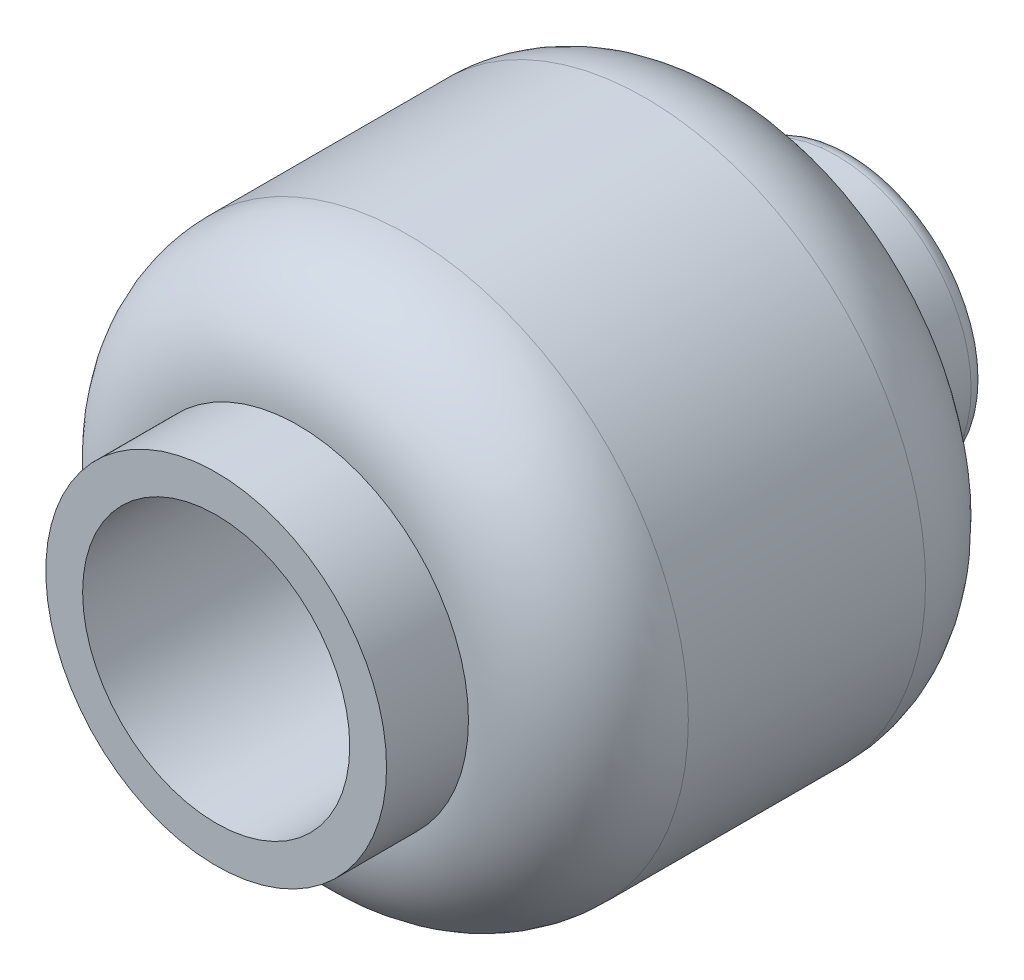
from build123d import *

# Parameters (mm, degrees)
FILLET2_R = 50.8
FILLET3_R = 7.62


with BuildPart() as part:
    # Sketch1 → Revolve1 (revolve)
    with BuildSketch(Plane(origin=(0, 0, 0), x_dir=(1, 0, 0), z_dir=(0, 1, 0)), mode=Mode.PRIVATE) as revolve1_sk:
        Polygon((-78.74, 0), (-61.722, 0), (-61.722, 147.1422), (0, 147.1422), (0, 294.2844), (-62.23, 294.2844), (-62.23, 249.0724), (-129.54, 249.0724), (-129.54, 37.846), (-78.74, 37.846), align=None)
    revolve(revolve1_sk.sketch.rotate(Axis((0, 0, 0), (0, 0, -1)), 180), axis=Axis((0, 0, 0), (0, 0, -1)))

    # Fillet2
    fillet2_edges = [part.edges().sort_by_distance(p)[0] for p in [
        (-129.54, 0, -37.846),
        (-129.54, 0, -249.0724),
    ]]
    fillet(fillet2_edges, radius=FILLET2_R - 0.0001)  # a hair under: the kernel refuses the full size

    # Fillet3
    fillet3_edges = [part.edges().sort_by_distance(p)[0] for p in [
        (-62.23, 0, -294.2844),
    ]]
    fillet(fillet3_edges, radius=FILLET3_R)


solid = part.part
